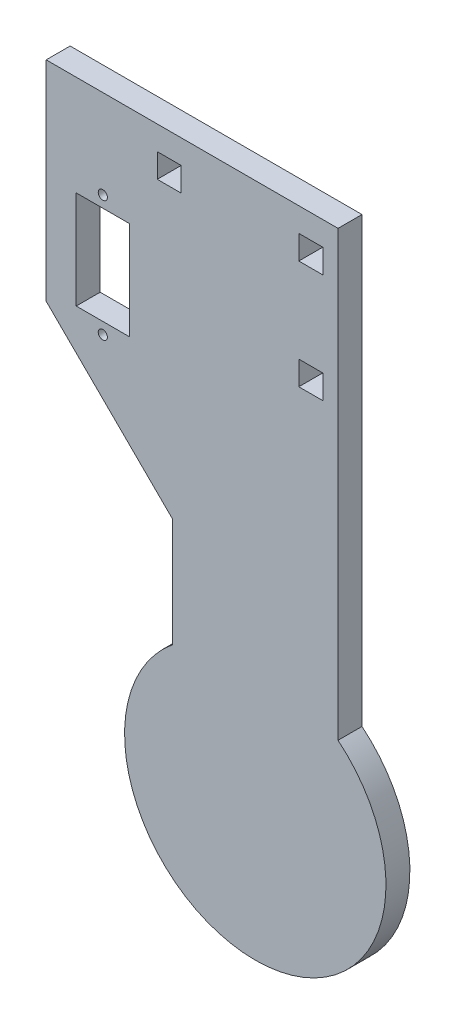
from build123d import *

# Parameters (mm, degrees)
EXTRUDE_1_DEPTH     = 5.5
SKETCH_2_W          = 12.2
SKETCH_2_H          = 22.5
CUT_EXTRUDE_1_DEPTH = 135.012126317
SKETCH_4_R          = 1.05
SKETCH_4_W          = 5.5
SKETCH_4_H          = 5.5
CUT_EXTRUDE_2_DEPTH = 135.012126317


with BuildPart() as part:
    # ｽｹｯﾁ1 → ﾎﾞｽ - 押し出し1 (new body)
    with BuildSketch(Plane.XY):
        with BuildLine():
            Line((19, 125), (-48, 125))
            Line((-48, 125), (-48, 77))
            Line((-48, 77), (-19, 48.216373532))
            Line((-19, 48.216373532), (-19, 23.216373532))
            ThreePointArc((-19, 23.216373532), (0, -30), (19, 23.216373532))
            Line((19, 23.216373532), (19, 125))
        make_face()
    extrude(amount=EXTRUDE_1_DEPTH)

    # ｽｹｯﾁ2 → ｶｯﾄ - 押し出し1 (cut, through all)
    with BuildSketch(Plane.XY.offset(5.5)):
        with Locations((-35, 90.75)):
            Rectangle(SKETCH_2_W, SKETCH_2_H)
    extrude(amount=-CUT_EXTRUDE_1_DEPTH, mode=Mode.SUBTRACT)

    # ｽｹｯﾁ4 → ｶｯﾄ - 押し出し2 (cut, through all)
    with BuildSketch(Plane.XY.offset(5.5)):
        with Locations((-35, 104.65)):
            Circle(SKETCH_4_R)
        with Locations((-35, 76.85)):
            Circle(SKETCH_4_R)
        with Locations((12.75, 116.75)):
            Rectangle(SKETCH_4_W, SKETCH_4_H)
        with Locations((-19.75, 116.75)):
            Rectangle(SKETCH_4_W, SKETCH_4_H)
        with Locations((12.75, 91.75)):
            Rectangle(SKETCH_4_W, SKETCH_4_H)
    extrude(amount=-CUT_EXTRUDE_2_DEPTH, mode=Mode.SUBTRACT)


solid = part.part
